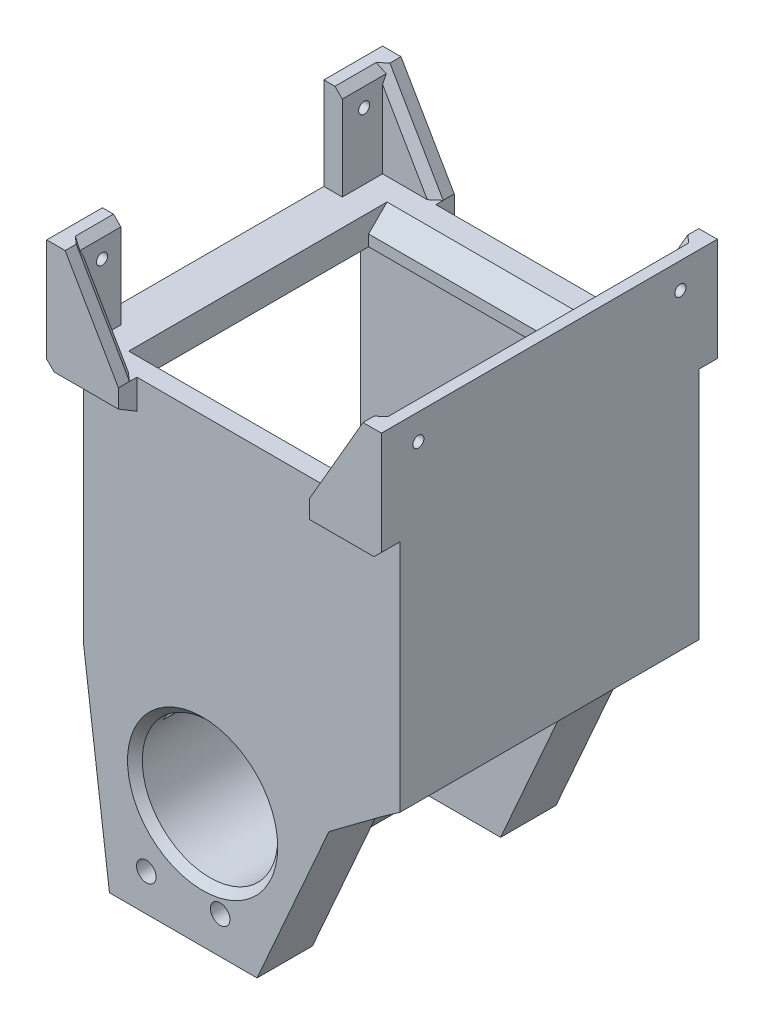
from build123d import *
from OCP.BRepFilletAPI import BRepFilletAPI_MakeChamfer

# Parameters (mm, degrees)
AUFSATZ_LINEAR_AUSTRAGEN1_DEPTH      = 81
SCHNITT_LINEAR_START                 = -5
SCHNITT_LINEAR_AUSTRAGEN1_DEPTH      = 70
AUFSATZ_LINEAR_START                 = -7
SKIZZE7_W                            = 3
SKIZZE7_H                            = 5
AUFSATZ_LINEAR_AUSTRAGEN2_DEPTH      = 72
SCHNITT_LINEAR_AUSTRAGEN2_DEPTH      = 156.38326520426057
AUFSATZ_LINEAR_AUSTRAGEN16_REACH     = 147.866
AUFSATZ_LINEAR_AUSTRAGEN17_DEPTH     = 5
AUFSATZ_LINEAR_AUSTRAGEN18_DEPTH     = 5
F_3_0_3_DURCHMESSER_BOHRUNG1_D       = 3
F_3_0_3_DURCHMESSER_BOHRUNG1_DEPTH   = 5
AUFSATZ_LINEAR_AUSTRAGEN19_DEPTH     = 65
F_21_5_21_5_DURCHMESSER_BOHRUNG1_D   = 36.7
SCHNITT_LINEAR_AUSTRAGEN3_DEPTH      = 167.766454168909
FASE1_SIZE                           = 2
AUFSATZ_LINEAR_AUSTRAGEN20_REACH     = 178.15
FASE3_SIZE                           = 2
FASE4_SIZE                           = 2
AUFSATZ_LINEAR_AUSTRAGEN21_REACH     = 178.15
F_3_0_3_DURCHMESSER_BOHRUNG2_D       = 3
AUFSATZ_LINEAR_START_2               = -15
AUFSATZ_LINEAR_AUSTRAGEN22_DEPTH     = 15
AUFSATZ_LINEAR_AUSTRAGEN23_DEPTH     = 15
FASE5_SIZE                           = 3
FASE5_SIZE2                          = 4.992838447051577
F_5_3_5_3_DURCHMESSER_BOHRUNG1_D     = 5.3
F_5_3_5_3_DURCHMESSER_BOHRUNG2_D     = 5.3
F_5_3_5_3_DURCHMESSER_BOHRUNG2_DEPTH = 15
FASE6_SIZE                           = 2
FASE7_SIZE                           = 5
FASE7_SIZE2                          = 10
AUFSATZ_LINEAR_AUSTRAGEN24_DEPTH     = 81
SCHNITT_LINEAR_START_2               = -66.212436
SCHNITT_LINEAR_AUSTRAGEN4_DEPTH      = 66.212436
SCHNITT_LINEAR_AUSTRAGEN5_REACH      = 186.868
AUFSATZ_LINEAR_AUSTRAGEN25_DEPTH     = 7
AUFSATZ_LINEAR_AUSTRAGEN27_REACH     = 169.248
VERRUNDUNG1_R                        = 20


with BuildPart() as part:
    # Skizze1 → Aufsatz-Linear austragen1 (new body)
    with BuildSketch(Plane.XY):
        with BuildLine():
            Line((-20, 19.999999999999996), (-32.24700538379256, 41.212435565298236))
            Line((-32.24700538379256, 41.212435565298236), (-32.24700538379256, 111.21243556529824))
            Line((-32.24700538379256, 111.21243556529824), (48.45299461620745, 111.21243556529824))
            Line((48.45299461620745, 111.21243556529824), (48.45299461620745, 41.21243556529823))
            Line((48.45299461620745, 41.21243556529823), (20, 19.999999999999996))
            ThreePointArc((20, 19.999999999999996), (1.22e-15, 0), (-20, 19.999999999999996))
        make_face()
    extrude(amount=AUFSATZ_LINEAR_AUSTRAGEN1_DEPTH)

    # Skizze2 → Schnitt-Linear austragen1 (cut)
    with BuildSketch(Plane.XY.offset(81).offset(SCHNITT_LINEAR_START)):
        with BuildLine():
            Line((10.6, 19.999999999999993), (39.96624327025953, 45))
            Line((39.96624327025953, 45), (39.96624327025955, 111.21243556529822))
            Line((39.96624327025955, 111.21243556529822), (-25.033756729740457, 111.21243556529824))
            Line((-25.033756729740457, 111.21243556529824), (-25.03375672974045, 45))
            Line((-25.03375672974045, 45), (-10.6, 19.999999999999993))
            ThreePointArc((-10.6, 19.999999999999993), (-1.7e-15, 9.4), (10.6, 19.999999999999993))
        make_face()
    extrude(amount=-SCHNITT_LINEAR_AUSTRAGEN1_DEPTH, mode=Mode.SUBTRACT)

    # Skizze7 → Aufsatz-Linear austragen2 (add)
    with BuildSketch(Plane.ZY.offset(-39.966243270259525).offset(AUFSATZ_LINEAR_START)):
        Polygon((5.999999999999991, 111.21243556529824), (10.999999999999993, 106.21243556529822), (10.999999999999993, 103.21243556529822), (5.999999999999991, 103.21243556529822), align=None)
        Polygon((76, 111.21243556529824), (71, 106.21243556529825), (71, 103.21243556529825), (76, 103.21243556529825), align=None)
        with Locations((74.5, 42.50000000000001)):
            Rectangle(SKIZZE7_W, SKIZZE7_H)
        with Locations((7.499999999999991, 42.50000000000001)):
            Rectangle(SKIZZE7_W, SKIZZE7_H)
    extrude(amount=AUFSATZ_LINEAR_AUSTRAGEN2_DEPTH)

    # Skizze8 → Schnitt-Linear austragen2 (cut, through all)
    with BuildSketch(Plane.ZY.offset(-39.966243270259525)):
        Polygon((10.999999999999993, 103.21243556529822), (5.999999999999991, 103.21243556529825), (5.999999999999991, 45.00000000000001), (76, 45.00000000000001), (76, 103.21243556529825), (71, 103.21243556529825), align=None)
    extrude(amount=SCHNITT_LINEAR_AUSTRAGEN2_DEPTH, mode=Mode.SUBTRACT)

    # Aufsatz-Linear austragen16: up to this face of the body (flat: up to its plane)
    aufsatz_linear_austragen16_end = Plane(part.part.faces().sort_by_distance((6.820175039, 63.309969875, 0))[0])
    # Skizze12 → Aufsatz-Linear austragen16 (add, up to the picked face)
    with BuildSketch(Plane.XY.offset(81), mode=Mode.PRIVATE) as aufsatz_linear_austragen16_sk1:
        Polygon((48.45299461620745, 136.21243556529822), (48.45299461620745, 111.21243556529824), (48.45299461620745, 103.21243556529824), (53.45299461620744, 108.21243556529842), (53.45299461620744, 136.21243556529822), align=None)
    aufsatz_linear_austragen16_tool1 = split(extrude(aufsatz_linear_austragen16_sk1.sketch, amount=-AUFSATZ_LINEAR_AUSTRAGEN16_REACH, mode=Mode.PRIVATE), bisect_by=aufsatz_linear_austragen16_end, keep=Keep.BOTH, mode=Mode.PRIVATE)
    # Skizze12 → Aufsatz-Linear austragen16 (add, up to the picked face)
    with BuildSketch(Plane.XY.offset(81), mode=Mode.PRIVATE) as aufsatz_linear_austragen16_sk2:
        Polygon((-37.24700538379256, 136.21243556529825), (-32.24700538379256, 136.21243556529825), (-32.24700538379256, 111.21243556529824), (-32.24700538379256, 103.21243556529825), (-37.24700538379256, 108.21243556529829), align=None)
    aufsatz_linear_austragen16_tool2 = split(extrude(aufsatz_linear_austragen16_sk2.sketch, amount=-AUFSATZ_LINEAR_AUSTRAGEN16_REACH, mode=Mode.PRIVATE), bisect_by=aufsatz_linear_austragen16_end, keep=Keep.BOTH, mode=Mode.PRIVATE)
    add(aufsatz_linear_austragen16_tool1.solids().sort_by(Axis((50.884689, 120.928283, 81), (0, 0, -1)))[0])
    add(aufsatz_linear_austragen16_tool2.solids().sort_by(Axis((-34.678699, 120.928283, 81), (0, 0, -1)))[0])

    # Skizze13 → Aufsatz-Linear austragen17 (add)
    with BuildSketch(Plane(origin=(0, 0, 0), x_dir=(-1, 0, 0), z_dir=(0, 0, -1))):
        Polygon((37.24700538379256, 136.21243556529825), (32.24700538379256, 136.21243556529825), (17.813248654051872, 111.21243556529824), (17.813248654051872, 103.21243556529825), (32.24700538379256, 103.21243556529825), (37.24700538379256, 108.21243556529829), align=None)
        Polygon((-53.45299461620744, 136.21243556529822), (-53.45299461620745, 108.21243556529842), (-48.45299461620745, 103.21243556529824), (-34.01923788646676, 103.21243556529824), (-34.01923788646676, 111.21243556529824), (-48.45299461620745, 136.21243556529822), align=None)
    extrude(amount=AUFSATZ_LINEAR_AUSTRAGEN17_DEPTH)

    # Skizze14 → Aufsatz-Linear austragen18 (add)
    with BuildSketch(Plane.XY.offset(81)):
        Polygon((-32.24700538379256, 136.21243556529825), (-37.24700538379256, 136.21243556529825), (-37.24700538379256, 108.21243556529829), (-32.24700538379256, 103.21243556529825), (-17.813248654051876, 103.21243556529825), (-17.813248654051872, 111.21243556529824), align=None)
        Polygon((53.45299461620744, 136.21243556529822), (48.45299461620745, 136.21243556529822), (34.019237886466776, 111.21243556529824), (34.019237886466776, 103.21243556529824), (48.45299461620745, 103.21243556529824), (53.45299461620745, 108.21243556529842), align=None)
    extrude(amount=AUFSATZ_LINEAR_AUSTRAGEN18_DEPTH)

    # Ø3.0 (3) Durchmesser Bohrung1
    with Locations(Plane.ZY.offset(37.24700538379256)):
        with Locations((5, 129.212435565), (76, 129.212435565)):
            Hole(F_3_0_3_DURCHMESSER_BOHRUNG1_D / 2, depth=F_3_0_3_DURCHMESSER_BOHRUNG1_DEPTH)

    # Skizze21 → Aufsatz-Linear austragen19 (add)
    with BuildSketch(Plane.ZY.offset(-39.966243270259525)):
        Polygon((65.99999999999999, 20), (65.99999999999999, 25), (8.999999999999991, 45.00000000000001), (5.999999999999991, 45.00000000000001), (5.999999999999995, 20), align=None)
    extrude(amount=AUFSATZ_LINEAR_AUSTRAGEN19_DEPTH)

    # Ø21.5 (21.5) Durchmesser Bohrung1 (through all)
    with Locations(Plane(origin=(0, 0, 0), x_dir=(-1, 0, 0), z_dir=(0, 0, -1))):
        with Locations((0, 20)):
            Hole(F_21_5_21_5_DURCHMESSER_BOHRUNG1_D / 2)

    # Skizze22 → Schnitt-Linear austragen3 (cut, through all)
    with BuildSketch(Plane(origin=(0, 8.3e-16, 5.999999999999997), x_dir=(-1, 0, 0), z_dir=(0, -1.4e-16, -1))):
        Polygon((-39.966243270259525, 34.88534527083473), (-39.96624327025953, 19.999999999999996), (-20, 19.999999999999996), align=None)
        Polygon((20.000000000000004, 20), (25.033756729740453, 28.718722408852198), (25.033756729740453, 20), align=None)
    extrude(amount=-SCHNITT_LINEAR_AUSTRAGEN3_DEPTH, mode=Mode.SUBTRACT)

    # Fase1
    fase1_edges = [part.edges().sort_by_distance(p)[0] for p in [
        (-25.030127018922215, 123.71243556529825, 81),
        (-25.030127018922215, 123.71243556529825, 0),
    ]]
    chamfer(fase1_edges, length=FASE1_SIZE)

    # Skizze23 → Aufsatz-Linear austragen20 (add, up to next)
    with BuildSketch(Plane(origin=(-17.81324865405192, 7.73e-15, 0), x_dir=(0, 0, -1), z_dir=(1, 2.2e-16, 0)), mode=Mode.PRIVATE) as aufsatz_linear_austragen20_sk1:
        Polygon((-82.99999999999997, 111.21243556529822), (-81, 107.2124355652983), (-81, 111.21243556529822), align=None)
    aufsatz_linear_austragen20_tool1 = extrude(aufsatz_linear_austragen20_sk1.sketch, amount=-AUFSATZ_LINEAR_AUSTRAGEN20_REACH, mode=Mode.PRIVATE) - part.part
    # Skizze23 → Aufsatz-Linear austragen20 (add, up to next)
    with BuildSketch(Plane(origin=(-17.81324865405192, 7.73e-15, 0), x_dir=(0, 0, -1), z_dir=(1, 2.2e-16, 0)), mode=Mode.PRIVATE) as aufsatz_linear_austragen20_sk2:
        Polygon((-1.73e-15, 107.21243556529824), (2.000000000000009, 111.21243556529822), (-1.1e-16, 111.21243556529822), align=None)
    aufsatz_linear_austragen20_tool2 = extrude(aufsatz_linear_austragen20_sk2.sketch, amount=-AUFSATZ_LINEAR_AUSTRAGEN20_REACH, mode=Mode.PRIVATE) - part.part
    add(aufsatz_linear_austragen20_tool1.solids().sort_by_distance((-17.813249, 109.879102, 81.666667))[0])
    add(aufsatz_linear_austragen20_tool2.solids().sort_by_distance((-17.813249, 109.879102, -0.666667))[0])

    # Fase3
    fase3_edges = [part.edges().sort_by_distance(p)[0] for p in [
        (41.236116251337116, 123.71243556529822, 81),
        (41.23611625133711, 123.71243556529822, 0),
    ]]
    chamfer(fase3_edges, length=FASE3_SIZE)

    # Fase4
    fase4_edges = [part.edges().sort_by_distance(p)[0] for p in [
        (48.45299461620745, 136.21243556529822, 40.5),
        (-32.247005383792555, 136.21243556529825, 40.50000000000001),
    ]]
    chamfer(fase4_edges, length=FASE4_SIZE)

    # Skizze24 → Aufsatz-Linear austragen21 (add, up to next)
    with BuildSketch(Plane.ZY.offset(-34.01923788646676), mode=Mode.PRIVATE) as aufsatz_linear_austragen21_sk1:
        Polygon((-1.999999999999974, 111.21243556529824), (0, 107.2124355652983), (0, 111.21243556529824), align=None)
    aufsatz_linear_austragen21_tool1 = extrude(aufsatz_linear_austragen21_sk1.sketch, amount=-AUFSATZ_LINEAR_AUSTRAGEN21_REACH, mode=Mode.PRIVATE) - part.part
    # Skizze24 → Aufsatz-Linear austragen21 (add, up to next)
    with BuildSketch(Plane.ZY.offset(-34.01923788646676), mode=Mode.PRIVATE) as aufsatz_linear_austragen21_sk2:
        Polygon((83, 111.21243556529824), (80.31502577388078, 105.84248711305969), (80.31502577388078, 111.21243556529824), align=None)
    aufsatz_linear_austragen21_tool2 = extrude(aufsatz_linear_austragen21_sk2.sketch, amount=-AUFSATZ_LINEAR_AUSTRAGEN21_REACH, mode=Mode.PRIVATE) - part.part
    add(aufsatz_linear_austragen21_tool1.solids().sort_by_distance((34.019238, 109.879102, -0.666667))[0])
    add(aufsatz_linear_austragen21_tool2.solids().sort_by_distance((34.019238, 109.422453, 81.210017))[0])

    # Ø3.0 (3) Durchmesser Bohrung2 (through all)
    with Locations(Plane(origin=(53.45299461620744, 0, 0), x_dir=(0, 0, -1), z_dir=(1, 0, 0))):
        with Locations((-76, 129.212435565), (-5, 129.212435565)):
            Hole(F_3_0_3_DURCHMESSER_BOHRUNG2_D / 2)

    # Skizze30 → Aufsatz-Linear austragen22 (add)
    with BuildSketch(Plane.XY.offset(81).offset(AUFSATZ_LINEAR_START_2)):
        with BuildLine():
            Line((-25.25, -13.5), (14.750000000000002, -13.5))
            Line((14.750000000000002, -13.5), (34.226497308103724, 30.606217782649114))
            Line((34.226497308103724, 30.606217782649114), (20.000000000000004, 19.999999999999996))
            ThreePointArc((20.000000000000004, 19.999999999999996), (-3.67e-15, -3.55e-15), (-20, 19.999999999999996))
            Line((-20, 19.999999999999996), (-32.24700538379256, 41.212435565298236))
            Line((-32.24700538379256, 41.212435565298236), (-25.25, -13.5))
        make_face()
    extrude(amount=AUFSATZ_LINEAR_AUSTRAGEN22_DEPTH)

    # Skizze31 → Aufsatz-Linear austragen23 (add)
    with BuildSketch(Plane(origin=(0, 0, 0), x_dir=(-1, 0, 0), z_dir=(0, 0, -1))):
        with BuildLine():
            Line((-34.226497308103724, 30.606217782649114), (-20, 19.999999999999996))
            ThreePointArc((-20, 19.999999999999996), (-3.22e-15, 1.066e-14), (20, 19.999999999999996))
            Line((20, 19.999999999999996), (32.24700538379256, 41.212435565298236))
            Line((32.24700538379256, 41.212435565298236), (25.25, -13.5))
            Line((25.25, -13.5), (-14.749999999999998, -13.5))
            Line((-14.749999999999998, -13.5), (-34.226497308103724, 30.606217782649114))
        make_face()
    extrude(amount=-AUFSATZ_LINEAR_AUSTRAGEN23_DEPTH)

    # Fase5: one chamfer whose edges measure the first distance from different faces: ONE call of the kernel's chamfer builder (chamfer() names one face for all edges)
    fase5_edges_1 = [part.edges().sort_by_distance(p)[0] for p in [
        (41.23611625133711, 103.21243556529824, -5),
    ]]
    fase5_side_1 = [part.faces().sort_by_distance(p)[0] for p in [
        (45.48560109201637, 116.83988365625363, -5),
    ]]
    fase5_edges_2 = [part.edges().sort_by_distance(p)[0] for p in [
        (-25.030127018922215, 103.21243556529825, -5),
    ]]
    fase5_side_2 = [part.faces().sort_by_distance(p)[0] for p in [
        (-29.279611859601495, 116.83988365625365, -5),
    ]]
    fase5_edges_3 = [part.edges().sort_by_distance(p)[0] for p in [
        (-25.03012701892222, 103.21243556529825, 86),
    ]]
    fase5_side_3 = [part.faces().sort_by_distance(p)[0] for p in [
        (-29.279611859601484, 116.83988365625365, 86),
    ]]
    fase5_edges_4 = [part.edges().sort_by_distance(p)[0] for p in [
        (41.23611625133711, 103.21243556529824, 86),
    ]]
    fase5_side_4 = [part.faces().sort_by_distance(p)[0] for p in [
        (45.485601092016374, 116.83988365625362, 86),
    ]]
    fase5 = BRepFilletAPI_MakeChamfer(part.part.solid().wrapped)
    for e in fase5_edges_1:
        fase5.Add(FASE5_SIZE, FASE5_SIZE2, e.wrapped, fase5_side_1[0].wrapped)  # the first distance lies on this face
    for e in fase5_edges_2:
        fase5.Add(FASE5_SIZE, FASE5_SIZE2, e.wrapped, fase5_side_2[0].wrapped)  # the first distance lies on this face
    for e in fase5_edges_3:
        fase5.Add(FASE5_SIZE, FASE5_SIZE2, e.wrapped, fase5_side_3[0].wrapped)  # the first distance lies on this face
    for e in fase5_edges_4:
        fase5.Add(FASE5_SIZE, FASE5_SIZE2, e.wrapped, fase5_side_4[0].wrapped)  # the first distance lies on this face
    add(Compound.cast(fase5.Shape()), mode=Mode.REPLACE)

    # Ø5.3 (5.3) Durchmesser Bohrung1 (through all)
    with Locations(Plane.XY.offset(81)):
        with Locations((-15.25, -3.5)):
            Hole(F_5_3_5_3_DURCHMESSER_BOHRUNG1_D / 2)

    # Ø5.3 (5.3) Durchmesser Bohrung2
    with Locations(Plane.XY.offset(81)):
        with Locations((4.75, -3.5)):
            Hole(F_5_3_5_3_DURCHMESSER_BOHRUNG2_D / 2, depth=F_5_3_5_3_DURCHMESSER_BOHRUNG2_DEPTH)

    # Fase6
    fase6_edges = [part.edges().sort_by_distance(p)[0] for p in [
        (-18.35, 20.000000000000004, 81),
    ]]
    chamfer(fase6_edges, length=FASE6_SIZE)

    # Fase7
    fase7_edges = [part.edges().sort_by_distance(p)[0] for p in [
        (-18.35, 20.000000000000004, 0),
    ]]
    fase7_side = [part.faces().sort_by_distance(p)[0] for p in [
        (6.001968826777722, 58.75126670064612, 0),
    ]]
    chamfer(fase7_edges, length=FASE7_SIZE, length2=FASE7_SIZE2, reference=fase7_side[0])

    # Skizze39 → Aufsatz-Linear austragen24 (add)
    with BuildSketch(Plane(origin=(0, 0, 0), x_dir=(-1, 0, 0), z_dir=(0, 0, -1))):
        Polygon((-48.45299461620745, 103.21243556529824), (-48.45299461620745, 111.21243556529824), (-53.45299461620744, 111.21243556529824), (-53.452994616207434, 44.71347325634675), (-48.45299461620745, 41.21243556529823), align=None)
    extrude(amount=-AUFSATZ_LINEAR_AUSTRAGEN24_DEPTH)

    # Skizze40 → Schnitt-Linear austragen4 (cut)
    with BuildSketch(Plane(origin=(0, 111.21243556529824, 0), x_dir=(1, 0, 0), z_dir=(0, 1, 0)).offset(SCHNITT_LINEAR_START_2)):
        Polygon((39.96624327025955, -76), (39.96624327025955, -5.999999999999991), (46.966243270259525, -5.999999999999991), (46.96624327025955, -76), align=None)
    extrude(amount=SCHNITT_LINEAR_AUSTRAGEN4_DEPTH, mode=Mode.SUBTRACT)

    # Schnitt-Linear austragen5: up to this face of the body (flat: up to its plane)
    schnitt_linear_austragen5_end = Plane(part.part.faces().sort_by_distance((-32.247005384, 122.674493846, 40.5))[0])
    # Skizze44 → Schnitt-Linear austragen5 (cut, up to the picked face)
    with BuildSketch(Plane.ZY.offset(37.24700538379256), mode=Mode.PRIVATE) as schnitt_linear_austragen5_sk1:
        Polygon((10.900000000000007, 136.21243556529822), (10.900000000000011, 111.21243556529822), (70.9, 111.21243556529824), (70.9, 136.21243556529828), align=None)
    schnitt_linear_austragen5_tool1 = split(extrude(schnitt_linear_austragen5_sk1.sketch, amount=-SCHNITT_LINEAR_AUSTRAGEN5_REACH, mode=Mode.PRIVATE), bisect_by=schnitt_linear_austragen5_end, keep=Keep.BOTH, mode=Mode.PRIVATE)
    add(schnitt_linear_austragen5_tool1.solids().sort_by(Axis((-37.247005, 123.712436, 40.9), (1, 0, 0)))[0], mode=Mode.SUBTRACT)

    # Skizze41 → Aufsatz-Linear austragen25 (add)
    with BuildSketch(Plane(origin=(39.96624327025955, 0, 0), x_dir=(0, 0, -1), z_dir=(1, 0, 0))):
        Polygon((-71, 106.21243556529824), (-76, 111.21243556529824), (-76, 103.21243556529824), (-71, 103.21243556529824), align=None)
        Polygon((-5.999999999999991, 103.21243556529821), (-5.999999999999991, 111.21243556529824), (-10.999999999999993, 106.21243556529821), (-10.999999999999993, 103.21243556529821), align=None)
    extrude(amount=AUFSATZ_LINEAR_AUSTRAGEN25_DEPTH)

    # Aufsatz-Linear austragen27: up to this face of the body (flat: up to its plane)
    aufsatz_linear_austragen27_end = Plane(part.part.faces().sort_by_distance((7.359618967, 74.106217763, 6))[0])
    # Skizze46 → Aufsatz-Linear austragen27 (add, up to the picked face)
    with BuildSketch(Plane(origin=(0, 0, 76), x_dir=(-1, 0, 0), z_dir=(0, 0, -1)), mode=Mode.PRIVATE) as aufsatz_linear_austragen27_sk1:
        Polygon((-46.96624327025955, 111.21243556529824), (-41.96624327025953, 106.21243556529825), (-41.96624327025953, 103.21243556529825), (-46.96624327025955, 103.21243556529825), align=None)
    aufsatz_linear_austragen27_tool1 = split(extrude(aufsatz_linear_austragen27_sk1.sketch, amount=AUFSATZ_LINEAR_AUSTRAGEN27_REACH, mode=Mode.PRIVATE), bisect_by=aufsatz_linear_austragen27_end, keep=Keep.BOTH, mode=Mode.PRIVATE)
    add(aufsatz_linear_austragen27_tool1.solids().sort_by(Axis((44.845031, 106.15183, 76), (0, 0, -1)))[0])

    # Verrundung1
    # the kernel refuses this fillet: 20 mm, written as the material it takes off along each edge
    with BuildSketch(Plane(origin=(39.96624327025953, 45, 73), x_dir=(0.9999999999999981, -6.2100252559308e-08, 0), z_dir=(0, 0, -1))) as verrundung1_piece_1_section:
        with BuildLine():
            CenterArc((7.364113453491243, 19.99668526013716), VERRUNDUNG1_R, 229.59166053400796, 39.36517362751647)
            Line((-5.600501285825948, 4.767805962530279), (0, 0))
            Line((0, 0), (7.0000000000000275, 0))
        make_face()
    verrundung1_piece_1 = extrude(amount=82.387765692995, mode=Mode.PRIVATE)
    verrundung1_piece_1 = split(verrundung1_piece_1, bisect_by=Plane(origin=(40.238295620402674, 34.86532480900939, 37.883824294323226), z_dir=(0, 0.9435999821328808, 0.33108771302908113)), keep=Keep.TOP, mode=Mode.PRIVATE)
    add(verrundung1_piece_1, mode=Mode.SUBTRACT)


solid = part.part
